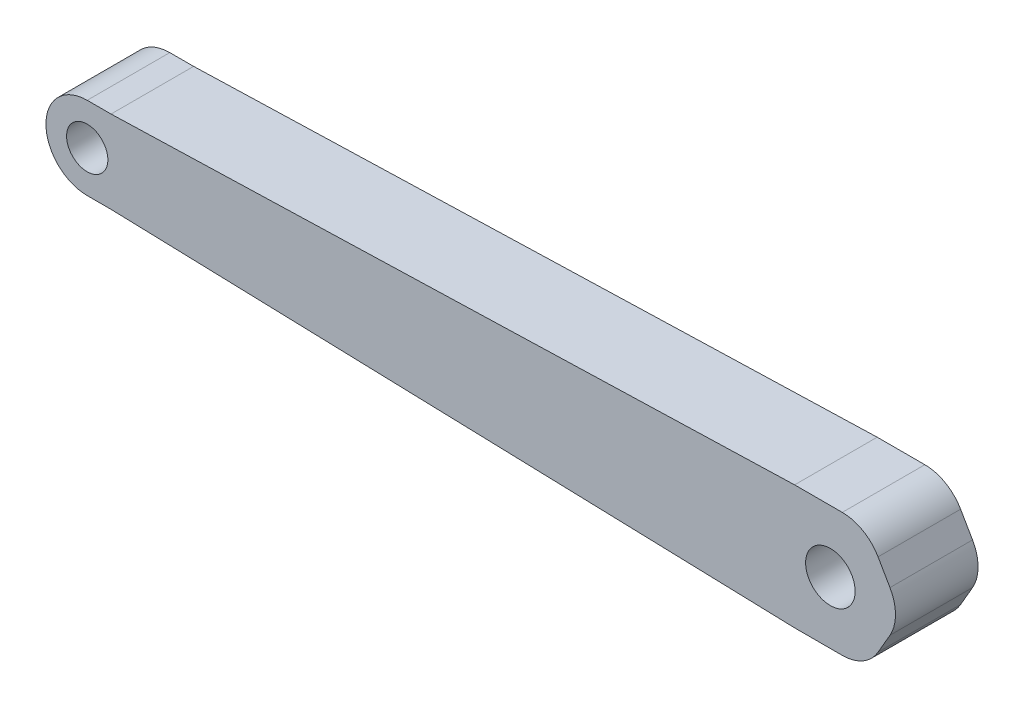
from build123d import *

# Parameters (mm, degrees)
SKETCH1_R           = 6.35
SKETCH1_R_2         = 7.62
BOSS_EXTRUDE1_DEPTH = 25.4
FILLET3_R           = 12.7


with BuildPart() as part:
    # Sketch1 → Boss-Extrude1 (new body)
    with BuildSketch(Plane.XY):
        Polygon((-106.967651581, 12.7), (103.301477372, 19.05), (125.298522628, 19.05), (136.297045256, 0), (125.298522628, -19.05), (103.301477372, -19.05), (-106.967651581, -12.7), (-121.632348419, -12.7), (-128.964696837, 0), (-121.632348419, 12.7), align=None)
        with Locations((-114.3, 0)):
            Circle(SKETCH1_R, mode=Mode.SUBTRACT)
        with Locations((114.3, 0)):
            Circle(SKETCH1_R_2, mode=Mode.SUBTRACT)
    extrude(amount=BOSS_EXTRUDE1_DEPTH)

    # Fillet3
    fillet3_edges = [part.edges().sort_by_distance(p)[0] for p in [
        (-128.964696837, 0, 12.7),
        (-121.632348419, 12.7, 12.7),
        (125.298522628, -19.05, 12.7),
        (136.297045256, 0, 12.7),
        (125.298522628, 19.05, 12.7),
        (-121.632348419, -12.7, 12.7),
    ]]
    fillet(fillet3_edges, radius=FILLET3_R - 0.0001)  # a hair under: the kernel refuses the full size


solid = part.part
